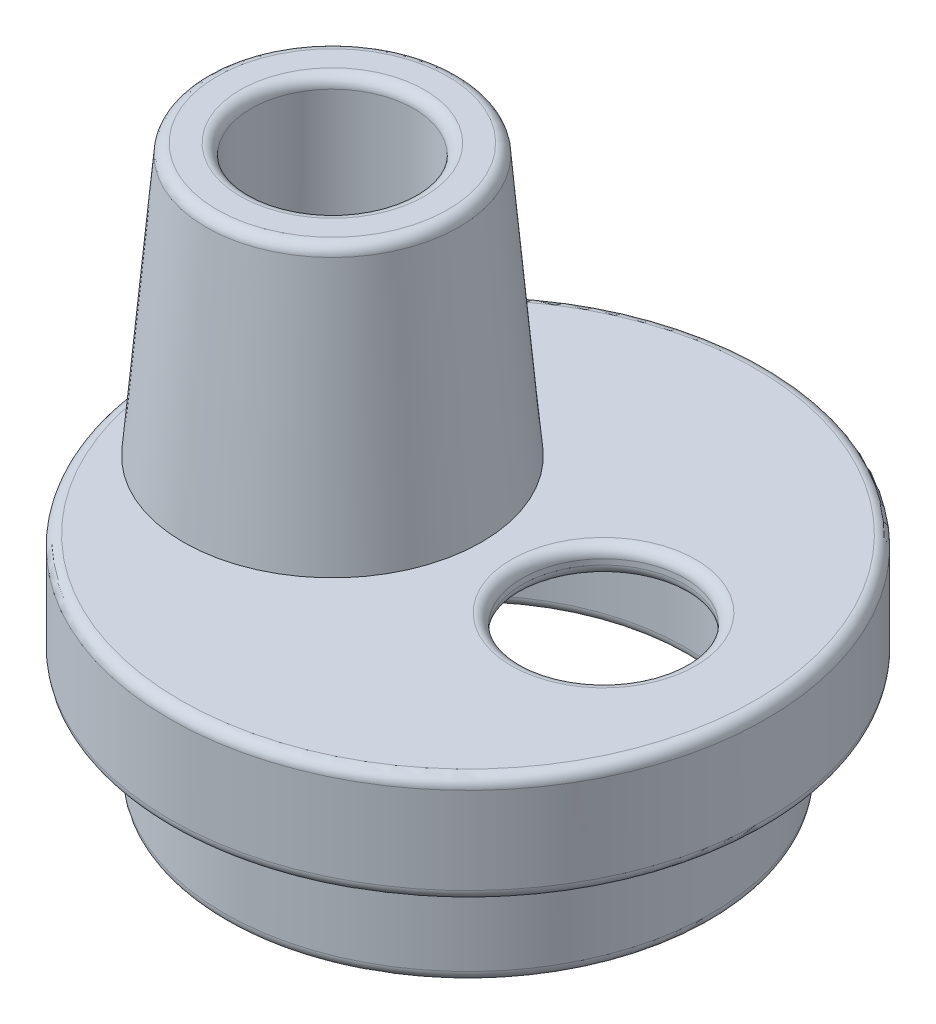
from build123d import *

# Parameters (mm, degrees)
CUT_EXTRUDE1_REACH  = 10.746
SKETCH2_R           = 1.5
BOSS_EXTRUDE1_START = 5
SKETCH3_R           = 2.75
SKETCH3_R_2         = 1.5
BOSS_EXTRUDE1_DEPTH = 5
DRAFT2_ANGLE        = 5
FILLET1_R           = 0.2


with BuildPart() as part:
    # Sketch1 → Revolve1 (revolve)
    with BuildSketch(Plane(origin=(0, 0, 0), x_dir=(0, 0, -1), z_dir=(1, 0, 0))):
        Polygon((-5.5, -2), (-4.5, -2), (-4.5, -4), (-4, -4), (-4, -1.5), (-5, -1.5), (-5, -0.5), (0, -0.5), (0, 0), (-5.5, 0), align=None)
    revolve(axis=Axis((0, 0, 0), (0, -1, 0)))

    # Sketch2 → Cut-Extrude1 (cut, up to next)
    with BuildSketch(Plane(origin=(0, 0, 0), x_dir=(1, 0, 0), z_dir=(0, 1, 0)), mode=Mode.PRIVATE) as cut_extrude1_sk1:
        with Locations((2.5, 0)):
            Circle(SKETCH2_R)
    cut_extrude1_tool1 = extrude(cut_extrude1_sk1.sketch, amount=-CUT_EXTRUDE1_REACH, mode=Mode.PRIVATE) & part.part
    # Sketch2 → Cut-Extrude1 (cut, up to next)
    with BuildSketch(Plane(origin=(0, 0, 0), x_dir=(1, 0, 0), z_dir=(0, 1, 0)), mode=Mode.PRIVATE) as cut_extrude1_sk2:
        with Locations((-2.5, 0)):
            Circle(SKETCH2_R)
    cut_extrude1_tool2 = extrude(cut_extrude1_sk2.sketch, amount=-CUT_EXTRUDE1_REACH, mode=Mode.PRIVATE) & part.part
    add(cut_extrude1_tool1.solids().sort_by_distance((2.5, 0, 0))[0], mode=Mode.SUBTRACT)
    add(cut_extrude1_tool2.solids().sort_by_distance((-2.5, 0, 0))[0], mode=Mode.SUBTRACT)

    # Sketch3 → Boss-Extrude1 (add)
    with BuildSketch(Plane(origin=(0, 0, 0), x_dir=(1, 0, 0), z_dir=(0, 1, 0)).offset(BOSS_EXTRUDE1_START)):
        with Locations((-2.5, 0)):
            Circle(SKETCH3_R)
        with Locations((-2.5, 0)):
            Circle(SKETCH3_R_2, mode=Mode.SUBTRACT)
    extrude(amount=-BOSS_EXTRUDE1_DEPTH)

    # Draft2
    draft2_faces = [part.faces().sort_by_distance(p)[0] for p in [
        (-5.25, 2.5, 0),
    ]]
    draft(draft2_faces, Plane.ZX, DRAFT2_ANGLE)

    # Fillet1
    fillet1_edges = [part.edges().sort_by_distance(p)[0] for p in [
        (-4, -0.5, 0),
        (0, -4, -4),
        (0, -4, -4.5),
        (0, -2, -5.5),
        (1, -0.5, 0),
        (1, 0, 0),
        (-4.812556682, 5, 0),
        (-4, 5, 0),
        (0, 0, -5.5),
    ]]
    fillet(fillet1_edges, radius=FILLET1_R)


solid = part.part
